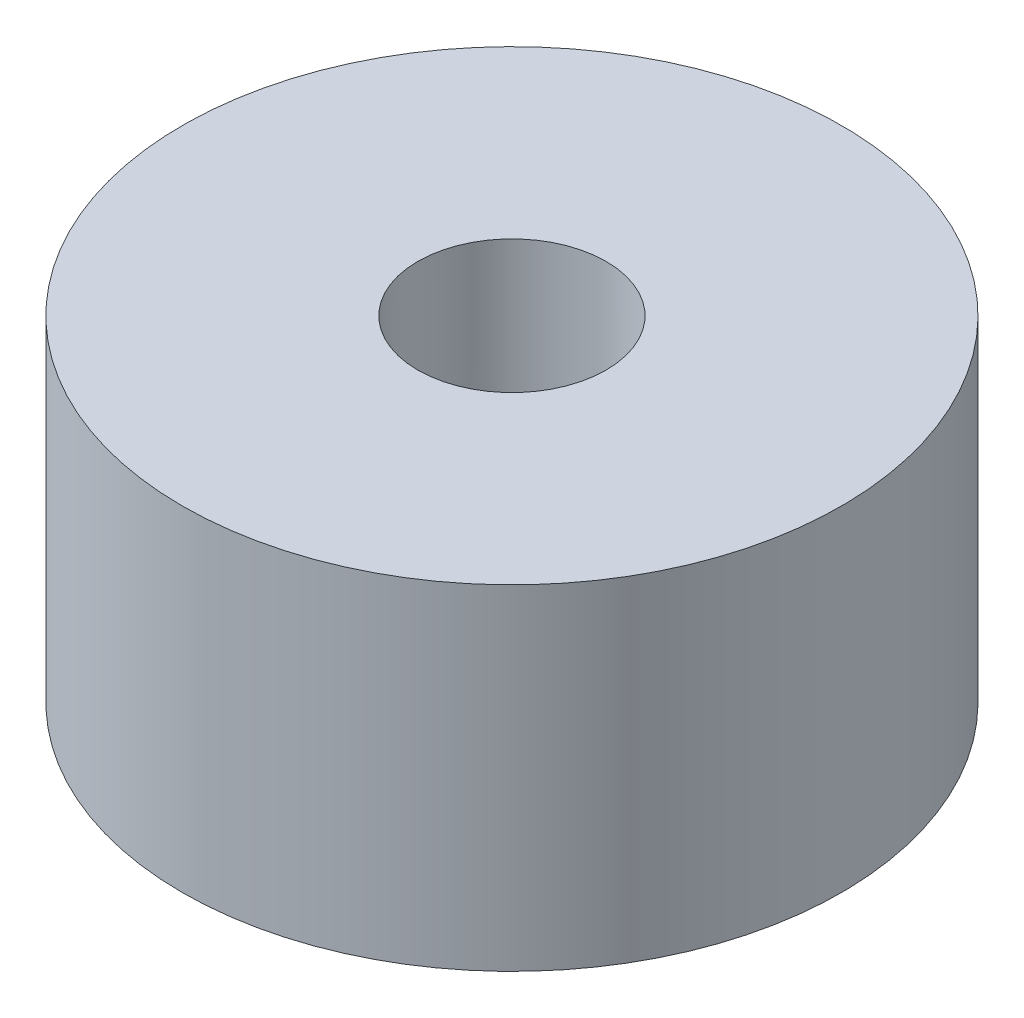
from build123d import *

# Parameters (mm, degrees)
SKETCH1_R           = 7.875
SKETCH1_R_2         = 2.25
BOSS_EXTRUDE1_DEPTH = 8
SKETCH3_R           = 4
CUT_EXTRUDE2_DEPTH  = 3


with BuildPart() as part:
    # Sketch1 → Boss-Extrude1 (new body)
    with BuildSketch(Plane(origin=(0, 0, 0), x_dir=(1, 0, 0), z_dir=(0, 1, 0))):
        Circle(SKETCH1_R)
        Circle(SKETCH1_R_2, mode=Mode.SUBTRACT)
    extrude(amount=BOSS_EXTRUDE1_DEPTH)

    # Sketch3 → Cut-Extrude2 (cut)
    with BuildSketch(Plane(origin=(0, 0, 0), x_dir=(-1, 0, 0), z_dir=(0, -1, 0))):
        Circle(SKETCH3_R)
    extrude(amount=-CUT_EXTRUDE2_DEPTH, mode=Mode.SUBTRACT)


solid = part.part
